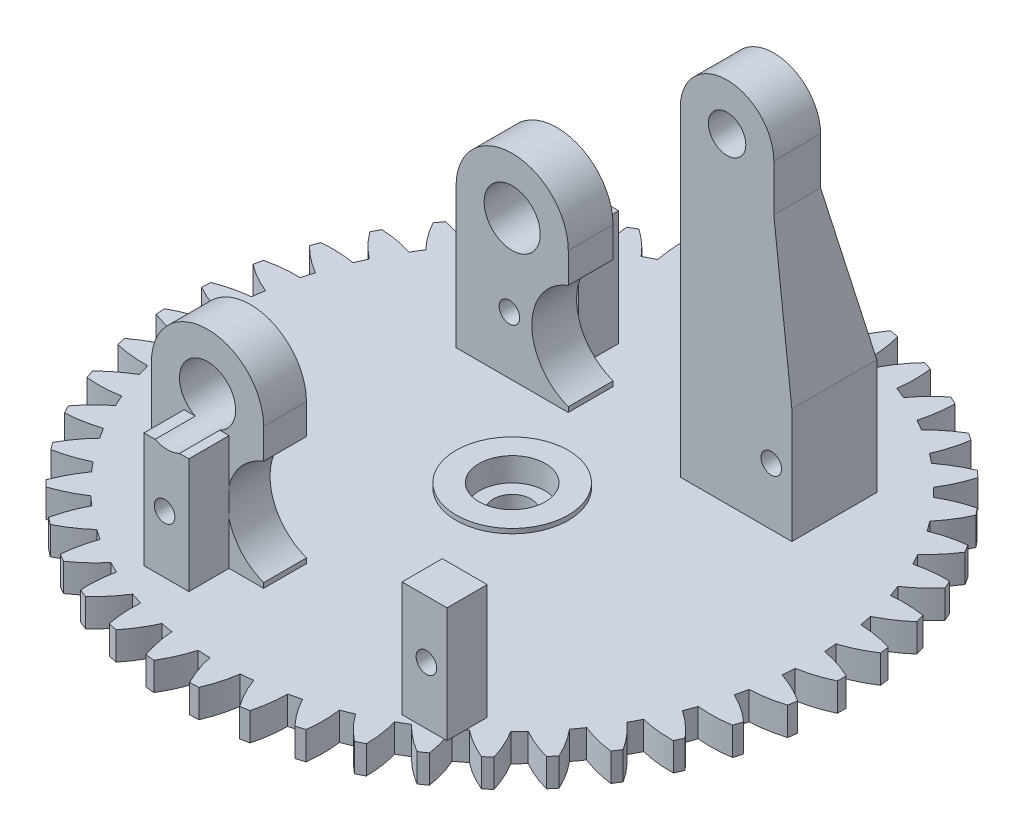
from build123d import *

# Parameters (mm, degrees)
SKETCH1_R                                 = 36
BOSS_EXTRUDE1_DEPTH                       = 3
ISO_START                                 = -50.576879948
ISO_SPUR_GEAR_1_5M_45T_20PA_3FW_2_R       = 0.4
ISO_SPUR_GEAR_1_5M_45T_20PA_3FW_S45_DEPTH = 3
BODY_MOVE_COPY2_ANGLE                     = 90
BOSS_EXTRUDE2_DEPTH                       = 3.5
BOSS_EXTRUDE2_DEPTH_BACK                  = 0.5
SKETCH2_R                                 = 6
CUT_EXTRUDE1_START                        = 1
SKETCH3_R                                 = 3.5
CUT_EXTRUDE1_DEPTH                        = 2.5
CUT_EXTRUDE1_DRAFT                        = -1
CUT_EXTRUDE2_START                        = 1
SKETCH4_R                                 = 2
CUT_EXTRUDE2_DEPTH                        = 1.5
CUT_EXTRUDE2_DRAFT                        = 1
SKETCH5_W                                 = 4.8
SKETCH5_H                                 = 4.3
BOSS_EXTRUDE3_DEPTH                       = 12.3
BOSS_EXTRUDE4_DEPTH                       = 5
SKETCH7_W                                 = 10
SKETCH7_H                                 = 5
BOSS_EXTRUDE5_DEPTH                       = 5
SKETCH8_W                                 = 11.922832302
SKETCH8_H                                 = 4.783876327
BOSS_EXTRUDE6_DEPTH                       = 12.3
LOFT2_START                               = -19.083876327
LOFT2_DEPTH                               = 9.083876327
LOFT2_START_2                             = 22.132052431
LOFT2_2_DEPTH                             = 4.867947569
SKETCH10_R                                = 6
BOSS_EXTRUDE7_DEPTH                       = 4.576618537
BOSS_EXTRUDE9_REACH                       = 93.866
BOSS_EXTRUDE9_END_RADIUS                  = 6
SKETCH12_W                                = 12
SKETCH12_H                                = 4.576618537
SKETCH13_R                                = 6
BOSS_EXTRUDE10_DEPTH                      = 4.783876327
BOSS_EXTRUDE11_REACH                      = 93.866
BOSS_EXTRUDE11_END_RADIUS                 = 6
SKETCH14_W                                = 12
SKETCH14_H                                = 4.783876327
CUT_EXTRUDE3_START                        = -10
SKETCH15_R                                = 6
CUT_EXTRUDE3_DEPTH                        = 4.783876327
CUT_EXTRUDE5_START                        = 18
SKETCH15_2_R                              = 6
CUT_EXTRUDE5_DEPTH                        = 4.576618537
CUT_EXTRUDE4_REACH                        = 95.188
SKETCH16_R                                = 3
SKETCH16_R_2                              = 2
SKETCH16_R_3                              = 1.1
CUT_EXTRUDE4_DIRECTION_2_REACH            = 95.188


with BuildPart() as part:
    # Sketch1 → Boss-Extrude1 (new body)
    with BuildSketch(Plane(origin=(0, 0, 0), x_dir=(1, 0, 0), z_dir=(0, 1, 0))):
        with Locations(Location((-40, 0, 0), (0, 0, 270))):
            Circle(SKETCH1_R)
    extrude(amount=BOSS_EXTRUDE1_DEPTH)


with BuildPart() as body_2:
    # ISO - Spur gear 1.5M 45T 20PA 3FW ---S45: read off the stored shape, not the designer's step
    # ISO - Spur gear 1.5M 45T 20PA 3FW -- 2 → ISO - Spur gear 1.5M 45T 20PA 3FW ---S45 (new body)
    with BuildSketch(Plane.YZ.offset(ISO_START)):
        with BuildLine():
            ThreePointArc((5.658725048, 38.151617139), (5.18462833, 38.204692645), (4.709856745, 38.251347216))
            ThreePointArc((4.709856745, 38.251347216), (3.88030129, 36.659989079), (3.269152011, 34.972659967))
            ThreePointArc((3.269152011, 34.972659967), (2.612386558, 35.002379054), (1.955147854, 35.018546004))
            ThreePointArc((1.955147854, 35.018546004), (1.463189432, 36.744396485), (0.746662265, 38.389745017))
            ThreePointArc((0.746662265, 38.389745017), (0.269792741, 38.376322486), (-0.206851461, 38.356447584))
            ThreePointArc((-0.206851461, 38.356447584), (-0.806859492, 36.66512463), (-1.177230284, 34.909160949))
            ThreePointArc((-1.177230284, 34.909160949), (-1.831740238, 34.847186726), (-2.484832745, 34.771726392))
            ThreePointArc((-2.484832745, 34.771726392), (-3.212195424, 36.412313636), (-4.150737656, 37.941928441))
            ThreePointArc((-4.150737656, 37.941928441), (-4.621098263, 37.862269127), (-5.090337744, 37.776251595))
            ThreePointArc((-5.090337744, 37.776251595), (-5.449119879, 36.017883501), (-5.571503337, 34.227463086))
            ThreePointArc((-5.571503337, 34.227463086), (-6.211018501, 34.075001813), (-6.847253107, 33.909382944))
            ThreePointArc((-6.847253107, 33.909382944), (-7.795862757, 35.432774786), (-8.938152396, 36.816883652))
            ThreePointArc((-8.938152396, 36.816883652), (-9.392849052, 36.672538033), (-9.8455506, 36.522052103))
            ThreePointArc((-9.8455506, 36.522052103), (-9.956123551, 34.730863505), (-9.828137621, 32.940834853))
            ThreePointArc((-9.828137621, 32.940834853), (-10.440210559, 32.700854014), (-11.047203682, 32.448300193))
            ThreePointArc((-11.047203682, 32.448300193), (-12.198596695, 33.824845544), (-13.522400372, 35.036508367))
            ThreePointArc((-13.522400372, 35.036508367), (-13.952582924, 34.830285965), (-14.379935219, 34.618260676))
            ThreePointArc((-14.379935219, 34.618260676), (-14.24014681, 32.829115021), (-13.864282592, 31.074319004))
            ThreePointArc((-13.864282592, 31.074319004), (-14.437, 30.751489553), (-15.00293721, 30.416916454))
            ThreePointArc((-15.00293721, 30.416916454), (-16.33470303, 31.619822424), (-17.814254414, 32.635455565))
            ThreePointArc((-17.814254414, 32.635455565), (-18.211549848, 32.371370266), (-18.605234962, 32.101932448))
            ThreePointArc((-18.605234962, 32.101932448), (-18.217806016, 30.349653422), (-17.601379279, 28.664245148))
            ThreePointArc((-17.601379279, 28.664245148), (-18.123593865, 28.264850594), (-18.637459837, 27.854770301))
            ThreePointArc((-18.637459837, 27.854770301), (-20.123677158, 28.860623693), (-21.730178462, 29.660459008))
            ThreePointArc((-21.730178462, 29.660459008), (-22.086853874, 29.343650931), (-22.439209176, 29.022044886))
            ThreePointArc((-22.439209176, 29.022044886), (-21.811680555, 27.340738607), (-20.966689345, 25.757522631))
            ThreePointArc((-20.966689345, 25.757522631), (-21.428236796, 25.289336733), (-21.880029714, 24.811730993))
            ThreePointArc((-21.880029714, 24.811730993), (-23.491771006, 25.600954016), (-25.193953511, 26.16942362))
            ThreePointArc((-25.193953511, 26.16942362), (-25.50306662, 25.806059075), (-25.807233913, 25.438544497))
            ThreePointArc((-25.807233913, 25.438544497), (-24.95181975, 23.860935679), (-23.894710859, 22.410727499))
            ThreePointArc((-23.894710859, 22.410727499), (-24.286607679, 21.882862965), (-24.667533907, 21.347027829))
            ThreePointArc((-24.667533907, 21.347027829), (-26.373428459, 21.904259155), (-28.138161119, 22.230298434))
            ThreePointArc((-28.138161119, 22.230298434), (-28.39369539, 21.827449897), (-28.643754404, 21.421180041))
            ThreePointArc((-28.643754404, 21.421180041), (-27.577104361, 19.977975045), (-26.328453212, 18.689001314))
            ThreePointArc((-26.328453212, 18.689001314), (-26.643071575, 18.111732425), (-26.945716818, 17.528097316))
            ThreePointArc((-26.945716818, 17.528097316), (-28.712561333, 17.84249107), (-30.505495633, 17.919754041))
            ThreePointArc((-30.505495633, 17.919754041), (-30.702477382, 17.485262502), (-30.893561004, 17.048144947))
            ThreePointArc((-30.893561004, 17.048144947), (-29.636436211, 15.767434118), (-28.220546378, 14.664783242))
            ThreePointArc((-28.220546378, 14.664783242), (-28.451762595, 14.049345882), (-28.670236207, 13.429270592))
            ThreePointArc((-28.670236207, 13.429270592), (-30.463641066, 13.494707458), (-32.249879581, 13.321690284))
            ThreePointArc((-32.249879581, 13.321690284), (-32.384474782, 12.864012626), (-32.512863786, 12.404555369))
            ThreePointArc((-32.512863786, 12.404555369), (-31.089732748, 11.311266285), (-29.534162915, 10.416400111))
            ThreePointArc((-29.534162915, 10.416400111), (-29.677476626, 9.774773067), (-29.807526267, 9.130326657))
            ThreePointArc((-29.807526267, 9.130326657), (-31.592584885, 8.94553298), (-33.337360512, 8.525603244))
            ThreePointArc((-33.337360512, 8.525603244), (-33.406949423, 8.053647642), (-33.470144863, 7.580793496))
            ThreePointArc((-33.470144863, 7.580793496), (-31.908707206, 6.696205786), (-30.243734772, 6.026541865))
            ThreePointArc((-30.243734772, 6.026541865), (-30.296356538, 5.371213677), (-30.33545094, 4.714939564))
            ThreePointArc((-30.33545094, 4.714939564), (-32.077419181, 4.283512143), (-33.746771848, 3.6248433))
            ThreePointArc((-33.746771848, 3.6248433), (-33.75, 3.147795833), (-33.746771848, 2.670748366))
            ThreePointArc((-33.746771848, 2.670748366), (-32.077419181, 2.012079523), (-30.33545094, 1.580652102))
            ThreePointArc((-30.33545094, 1.580652102), (-30.296356538, 0.924377989), (-30.243734772, 0.269049801))
            ThreePointArc((-30.243734772, 0.269049801), (-31.908707206, -0.400614119), (-33.470144863, -1.28520183))
            ThreePointArc((-33.470144863, -1.28520183), (-33.406949423, -1.758055976), (-33.337360512, -2.230011578))
            ThreePointArc((-33.337360512, -2.230011578), (-31.592584885, -2.649941313), (-29.807526267, -2.83473499))
            ThreePointArc((-29.807526267, -2.83473499), (-29.677476626, -3.4791814), (-29.534162915, -4.120808445))
            ThreePointArc((-29.534162915, -4.120808445), (-31.089732748, -5.015674619), (-32.512863786, -6.108963703))
            ThreePointArc((-32.512863786, -6.108963703), (-32.384474782, -6.568420959), (-32.249879581, -7.026098617))
            ThreePointArc((-32.249879581, -7.026098617), (-30.463641066, -7.199115791), (-28.670236207, -7.133678926))
            ThreePointArc((-28.670236207, -7.133678926), (-28.451762595, -7.753754215), (-28.220546378, -8.369191576))
            ThreePointArc((-28.220546378, -8.369191576), (-29.636436211, -9.471842451), (-30.893561004, -10.752553281))
            ThreePointArc((-30.893561004, -10.752553281), (-30.702477382, -11.189670835), (-30.505495633, -11.624162374))
            ThreePointArc((-30.505495633, -11.624162374), (-28.712561333, -11.546899404), (-26.945716818, -11.23250565))
            ThreePointArc((-26.945716818, -11.23250565), (-26.643071575, -11.816140759), (-26.328453212, -12.393409648))
            ThreePointArc((-26.328453212, -12.393409648), (-27.577104362, -13.682383379), (-28.643754404, -15.125588375))
            ThreePointArc((-28.643754404, -15.125588375), (-28.39369539, -15.531858231), (-28.138161119, -15.934706767))
            ThreePointArc((-28.138161119, -15.934706767), (-26.373428459, -15.608667488), (-24.667533907, -15.051436163))
            ThreePointArc((-24.667533907, -15.051436163), (-24.286607679, -15.587271299), (-23.894710859, -16.115135833))
            ThreePointArc((-23.894710859, -16.115135833), (-24.95181975, -17.565344013), (-25.807233913, -19.142952831))
            ThreePointArc((-25.807233913, -19.142952831), (-25.50306662, -19.510467408), (-25.193953511, -19.873831953))
            ThreePointArc((-25.193953511, -19.873831953), (-23.491771005, -19.30536235), (-21.880029714, -18.516139326))
            ThreePointArc((-21.880029714, -18.516139326), (-21.428236796, -18.993745067), (-20.966689345, -19.461930964))
            ThreePointArc((-20.966689345, -19.461930964), (-21.811680555, -21.045146941), (-22.439209176, -22.72645322))
            ThreePointArc((-22.439209176, -22.72645322), (-22.086853874, -23.048059265), (-21.730178462, -23.364867341))
            ThreePointArc((-21.730178462, -23.364867341), (-20.123677157, -22.565032027), (-18.637459837, -21.559178634))
            ThreePointArc((-18.637459837, -21.559178634), (-18.123593865, -21.969258927), (-17.601379279, -22.368653482))
            ThreePointArc((-17.601379279, -22.368653482), (-18.217806016, -24.054061756), (-18.605234962, -25.806340782))
            ThreePointArc((-18.605234962, -25.806340782), (-18.211549847, -26.075778599), (-17.814254414, -26.339863898))
            ThreePointArc((-17.814254414, -26.339863898), (-16.33470303, -25.324230758), (-15.00293721, -24.121324788))
            ThreePointArc((-15.00293721, -24.121324788), (-14.437, -24.455897887), (-13.864282592, -24.778727338))
            ThreePointArc((-13.864282592, -24.778727338), (-14.24014681, -26.533523355), (-14.379935219, -28.32266901))
            ThreePointArc((-14.379935219, -28.32266901), (-13.952582924, -28.534694299), (-13.522400372, -28.7409167))
            ThreePointArc((-13.522400372, -28.7409167), (-12.198596695, -27.529253878), (-11.047203682, -26.152708527))
            ThreePointArc((-11.047203682, -26.152708527), (-10.440210558, -26.405262347), (-9.828137621, -26.645243187))
            ThreePointArc((-9.828137621, -26.645243187), (-9.956123551, -28.435271839), (-9.8455506, -30.226460437))
            ThreePointArc((-9.8455506, -30.226460437), (-9.392849052, -30.376946366), (-8.938152396, -30.521291986))
            ThreePointArc((-8.938152396, -30.521291986), (-7.795862757, -29.13718312), (-6.847253107, -27.613791278))
            ThreePointArc((-6.847253107, -27.613791278), (-6.2110185, -27.779410146), (-5.571503337, -27.93187142))
            ThreePointArc((-5.571503337, -27.93187142), (-5.449119879, -29.722291835), (-5.090337744, -31.480659928))
            ThreePointArc((-5.090337744, -31.480659928), (-4.621098263, -31.56667746), (-4.150737656, -31.646336775))
            ThreePointArc((-4.150737656, -31.646336775), (-3.212195424, -30.11672197), (-2.484832745, -28.476134726))
            ThreePointArc((-2.484832745, -28.476134726), (-1.831740238, -28.55159506), (-1.177230284, -28.613569282))
            ThreePointArc((-1.177230284, -28.613569282), (-0.806859492, -30.369532963), (-0.206851461, -32.060855917))
            ThreePointArc((-0.206851461, -32.060855917), (0.269792741, -32.080730819), (0.746662265, -32.09415335))
            ThreePointArc((0.746662265, -32.09415335), (1.463189432, -30.448804818), (1.955147854, -28.722954337))
            ThreePointArc((1.955147854, -28.722954337), (2.612386558, -28.706787387), (3.269152011, -28.677068301))
            ThreePointArc((3.269152011, -28.677068301), (3.88030129, -30.364397413), (4.709856745, -31.955755549))
            ThreePointArc((4.709856745, -31.955755549), (5.18462833, -31.909100979), (5.658725048, -31.856025472))
            ThreePointArc((5.658725048, -31.856025472), (6.139290765, -30.126968051), (6.386269518, -28.349446049))
            ThreePointArc((6.386269518, -28.349446049), (7.034862015, -28.241966486), (7.681099774, -28.12113254))
            ThreePointArc((7.681099774, -28.12113254), (8.521132216, -29.70698514), (9.564088741, -31.167404484))
            ThreePointArc((9.564088741, -31.167404484), (10.02774682, -31.055128518), (10.489842978, -30.936588029))
            ThreePointArc((10.489842978, -30.936588029), (10.725093579, -29.157475855), (10.722285503, -27.362879776))
            ThreePointArc((10.722285503, -27.362879776), (11.349607678, -27.166179567), (11.972739461, -26.956582655))
            ThreePointArc((11.972739461, -26.956582655), (13.025304789, -28.410091927), (14.261362422, -29.711147077))
            ThreePointArc((14.261362422, -29.711147077), (14.704882418, -29.53543504), (15.14598384, -29.353736823))
            ThreePointArc((15.14598384, -29.353736823), (15.131340441, -27.559198291), (14.878800191, -25.782457906))
            ThreePointArc((14.878800191, -25.782457906), (15.472641933, -25.500365599), (16.060539187, -25.206085287))
            ThreePointArc((16.060539187, -25.206085287), (17.305150414, -26.498960326), (18.710250699, -27.615327722))
            ThreePointArc((18.710250699, -27.615327722), (19.125, -27.37959965), (19.536521149, -27.138280255))
            ThreePointArc((19.536521149, -27.138280255), (19.272268766, -25.363244016), (18.774911752, -23.638941556))
            ThreePointArc((18.774911752, -23.638941556), (19.323714605, -23.276947754), (19.864934581, -22.903711875))
            ThreePointArc((19.864934581, -22.903711875), (21.277366765, -24.010788339), (22.824161022, -24.92073916))
            ThreePointArc((22.824161022, -24.92073916), (23.202067005, -24.629583231), (23.575998091, -24.333339666))
            ThreePointArc((23.575998091, -24.333339666), (23.067280096, -22.612354781), (22.334786806, -20.974051832))
            ThreePointArc((22.334786806, -20.974051832), (22.827868947, -20.539202334), (23.311877412, -20.094275498))
            ThreePointArc((23.311877412, -20.094275498), (24.864639168, -20.994005403), (26.523020808, -21.679828492))
            ThreePointArc((26.523020808, -21.679828492), (26.856727962, -21.338911725), (27.18579084, -20.993510033))
            ThreePointArc((27.18579084, -20.993510033), (26.442508851, -19.360073515), (25.489136433, -17.839657781))
            ThreePointArc((25.489136433, -17.839657781), (25.91690058, -17.340416438), (26.33427686, -16.83245864))
            ThreePointArc((26.33427686, -16.83245864), (27.997145446, -17.507329767), (29.734835956, -17.955676358))
            ThreePointArc((29.734835956, -17.955676358), (30.017849052, -17.57163431), (30.295638888, -17.183797342))
            ThreePointArc((30.295638888, -17.183797342), (29.332260042, -15.669702176), (28.176564807, -14.296766818))
            ThreePointArc((28.176564807, -14.296766818), (28.530685017, -13.742850795), (28.873305358, -13.181748856))
            ThreePointArc((28.873305358, -13.181748856), (30.613914929, -13.618625606), (32.397092139, -13.820769142))
            ThreePointArc((32.397092139, -13.820769142), (32.623902648, -13.401076755), (32.845012579, -12.978353317))
            ThreePointArc((32.845012579, -12.978353317), (31.680287951, -11.613069642), (30.344764191, -10.414337287))
            ThreePointArc((30.344764191, -10.414337287), (30.618347917, -9.816527929), (30.879543604, -9.21320306))
            ThreePointArc((30.879543604, -9.21320306), (32.664015174, -9.403582123), (34.457971569, -9.355588111))
            ThreePointArc((34.457971569, -9.355588111), (34.624164883, -8.90841422), (34.784291255, -8.459032142))
            ThreePointArc((34.784291255, -8.459032142), (33.440890884, -7.269133652), (31.951533051, -6.26793626))
            ThreePointArc((31.951533051, -6.26793626), (32.139255296, -5.637869246), (32.313942452, -5.00406448))
            ThreePointArc((32.313942452, -5.00406448), (34.107543312, -4.944240346), (35.877361571, -4.647042933))
            ThreePointArc((35.877361571, -4.647042933), (35.979702926, -4.181091268), (36.075729062, -3.713797262))
            ThreePointArc((36.075729062, -3.713797262), (34.579800709, -2.722443978), (32.965597458, -1.938268719))
            ThreePointArc((32.965597458, -1.938268719), (33.063804423, -1.288207587), (33.148582961, -0.636259212))
            ThreePointArc((33.148582961, -0.636259212), (34.91640271, -0.327396289), (36.627635334, 0.213219915))
            ThreePointArc((36.627635334, 0.213219915), (36.664132772, 0.688880134), (36.694189633, 1.164990722))
            ThreePointArc((36.694189633, 1.164990722), (35.07484984, 1.938503236), (33.367219802, 2.490393283))
            ThreePointArc((33.367219802, 2.490393283), (33.374, 3.147795833), (33.367219802, 3.805198383))
            ThreePointArc((33.367219802, 3.805198383), (35.074849841, 4.35708843), (36.694189633, 5.130600945))
            ThreePointArc((36.694189633, 5.130600945), (36.664132772, 5.606711533), (36.627635334, 6.082371752))
            ThreePointArc((36.627635334, 6.082371752), (34.91640271, 6.622987955), (33.148582961, 6.931850878))
            ThreePointArc((33.148582961, 6.931850878), (33.063804423, 7.583799253), (32.965597458, 8.233860386))
            ThreePointArc((32.965597458, 8.233860386), (34.579800709, 9.018035645), (36.075729062, 10.009388929))
            ThreePointArc((36.075729062, 10.009388929), (35.979702926, 10.476682935), (35.877361571, 10.942634599))
            ThreePointArc((35.877361571, 10.942634599), (34.107543312, 11.239832012), (32.313942452, 11.299656146))
            ThreePointArc((32.313942452, 11.299656146), (32.139255296, 11.933460912), (31.951533051, 12.563527927))
            ThreePointArc((31.951533051, 12.563527927), (33.440890884, 13.564725318), (34.784291255, 14.754623808))
            ThreePointArc((34.784291255, 14.754623808), (34.624164883, 15.204005886), (34.457971569, 15.651179777))
            ThreePointArc((34.457971569, 15.651179777), (32.664015174, 15.69917379), (30.879543604, 15.508794726))
            ThreePointArc((30.879543604, 15.508794726), (30.618347917, 16.112119595), (30.344764191, 16.709928953))
            ThreePointArc((30.344764191, 16.709928953), (31.680287951, 17.908661308), (32.845012579, 19.273944983))
            ThreePointArc((32.845012579, 19.273944983), (32.623902648, 19.696668421), (32.397092139, 20.116360809))
            ThreePointArc((32.397092139, 20.116360809), (30.613914929, 19.914217272), (28.873305358, 19.477340523))
            ThreePointArc((28.873305358, 19.477340523), (28.530685017, 20.038442462), (28.176564807, 20.592358485))
            ThreePointArc((28.176564807, 20.592358485), (29.332260042, 21.965293842), (30.295638888, 23.479389008))
            ThreePointArc((30.295638888, 23.479389008), (30.017849052, 23.867225976), (29.734835956, 24.251268024))
            ThreePointArc((29.734835956, 24.251268024), (27.997145446, 23.802921433), (26.33427686, 23.128050306))
            ThreePointArc((26.33427686, 23.128050306), (25.91690058, 23.636008104), (25.489136433, 24.135249447))
            ThreePointArc((25.489136433, 24.135249447), (26.442508851, 25.655665181), (27.18579084, 27.289101699))
            ThreePointArc((27.18579084, 27.289101699), (26.856727962, 27.634503392), (26.523020808, 27.975420159))
            ThreePointArc((26.523020808, 27.975420159), (24.864639168, 27.289597069), (23.311877412, 26.389867164))
            ThreePointArc((23.311877412, 26.389867164), (22.827868947, 26.834794), (22.334786806, 27.269643498))
            ThreePointArc((22.334786806, 27.269643498), (23.067280096, 28.907946447), (23.575998091, 30.628931332))
            ThreePointArc((23.575998091, 30.628931332), (23.202067005, 30.925174898), (22.824161022, 31.216330827))
            ThreePointArc((22.824161022, 31.216330827), (21.277366765, 30.306380005), (19.864934581, 29.199303541))
            ThreePointArc((19.864934581, 29.199303541), (19.323714605, 29.572539421), (18.774911752, 29.934533222))
            ThreePointArc((18.774911752, 29.934533222), (19.272268766, 31.658835682), (19.536521149, 33.433871922))
            ThreePointArc((19.536521149, 33.433871922), (19.125, 33.675191317), (18.710250699, 33.910919389))
            ThreePointArc((18.710250699, 33.910919389), (17.305150414, 32.794551992), (16.060539187, 31.501676953))
            ThreePointArc((16.060539187, 31.501676953), (15.472641932, 31.795957265), (14.878800191, 32.078049573))
            ThreePointArc((14.878800191, 32.078049573), (15.131340441, 33.854789958), (15.14598384, 35.64932849))
            ThreePointArc((15.14598384, 35.64932849), (14.704882418, 35.831026707), (14.261362422, 36.006738743))
            ThreePointArc((14.261362422, 36.006738743), (13.025304789, 34.705683594), (11.972739461, 33.252174322))
            ThreePointArc((11.972739461, 33.252174322), (11.349607679, 33.461771234), (10.722285503, 33.658471442))
            ThreePointArc((10.722285503, 33.658471442), (10.725093579, 35.453067521), (10.489842978, 37.232179695))
            ThreePointArc((10.489842978, 37.232179695), (10.02774682, 37.350720184), (9.564088741, 37.46299615))
            ThreePointArc((9.564088741, 37.46299615), (8.521132216, 36.002576806), (7.681099774, 34.416724206))
            ThreePointArc((7.681099774, 34.416724206), (7.034862015, 34.537558153), (6.386269518, 34.645037716))
            ThreePointArc((6.386269518, 34.645037716), (6.139290765, 36.422559718), (5.658725048, 38.151617139))
        make_face()
        with Locations((1.5, 3.147795833)):
            Circle(ISO_SPUR_GEAR_1_5M_45T_20PA_3FW_2_R, mode=Mode.SUBTRACT)
    extrude(amount=ISO_SPUR_GEAR_1_5M_45T_20PA_3FW_S45_DEPTH)


with BuildPart() as body_2_1:
    # Body-Move/Copy2: read off the stored shape, not the designer's step
    # Body-Move/Copy2: moved
    add(body_2.part.moved(Location((50.5768799, 38.5, -3.1477958))).rotate(Axis((0, 0, 0), (0, 0, 1)), BODY_MOVE_COPY2_ANGLE))

    # Sketch2 → Boss-Extrude2 (add, two sides: drawn at the far end of the back side and taken through both)
    with BuildSketch(Plane(origin=(0, 0, 0), x_dir=(1, 0, 0), z_dir=(0, 1, 0)).offset(-BOSS_EXTRUDE2_DEPTH_BACK)):
        with Locations(Location((-40, 0, 0), (0, 0, 270))):
            Circle(SKETCH2_R)
    extrude(amount=BOSS_EXTRUDE2_DEPTH + BOSS_EXTRUDE2_DEPTH_BACK)


with BuildPart() as cut_extrude1_tool:
    # Sketch3 → Cut-Extrude1 (with draft: the straight prism first)
    with BuildSketch(Plane(origin=(0, 0, 0), x_dir=(1, 0, 0), z_dir=(0, 1, 0)).offset(CUT_EXTRUDE1_START)):
        with Locations((-40, 0)):
            Circle(SKETCH3_R)
    extrude(amount=CUT_EXTRUDE1_DEPTH)
    # Cut-Extrude1: the draft: its side faces are tilted about the plane it starts from
    cut_extrude1_sides = [cut_extrude1_tool.faces().sort_by_distance(p)[0] for p in [
        (-43.5, 2.25, 0),
    ]]
    draft(cut_extrude1_sides, Plane(origin=(0, 0, 0), x_dir=(1, 0, 0), z_dir=(0, 1, 0)).offset(CUT_EXTRUDE1_START), CUT_EXTRUDE1_DRAFT)


with BuildPart() as body_2_2:
    add(body_2_1.part)

    # Cut-Extrude1: cut by cut_extrude1_tool
    add(cut_extrude1_tool.part, mode=Mode.SUBTRACT)


with BuildPart() as cut_extrude2_tool:
    # Sketch4 → Cut-Extrude2 (with draft: the straight prism first)
    with BuildSketch(Plane(origin=(0, 0, 0), x_dir=(1, 0, 0), z_dir=(0, 1, 0)).offset(CUT_EXTRUDE2_START)):
        with Locations((-40, 0)):
            Circle(SKETCH4_R)
    extrude(amount=-CUT_EXTRUDE2_DEPTH)
    # Cut-Extrude2: the draft: its side faces are tilted about the plane it starts from
    cut_extrude2_sides = [cut_extrude2_tool.faces().sort_by_distance(p)[0] for p in [
        (-42, 0.25, 0),
    ]]
    draft(cut_extrude2_sides, Plane(origin=(0, 0, 0), x_dir=(1, 0, 0), z_dir=(0, 1, 0)).offset(CUT_EXTRUDE2_START), CUT_EXTRUDE2_DRAFT)


with BuildPart() as body_2_3:
    add(body_2_2.part)

    # Cut-Extrude2: cut by cut_extrude2_tool
    add(cut_extrude2_tool.part, mode=Mode.SUBTRACT)

    # Sketch5 → Boss-Extrude3 (add)
    with BuildSketch(Plane(origin=(0, 3, 0), x_dir=(1, 0, 0), z_dir=(0, 1, 0))):
        with Locations((-50.095834404, -24.726618537)):
            Rectangle(SKETCH5_W, SKETCH5_H)
        with Locations((-22.495834404, -24.726618537)):
            Rectangle(SKETCH5_W, SKETCH5_H)
        with Locations((-50.095834404, 16.933876327)):
            Rectangle(SKETCH5_W, SKETCH5_H)
        with Locations((-22.495834404, 16.933876327)):
            Rectangle(SKETCH5_W, SKETCH5_H)
    extrude(amount=BOSS_EXTRUDE3_DEPTH)

    # Sketch8 → Boss-Extrude6 (add)
    with BuildSketch(Plane(origin=(0, 3, 0), x_dir=(1, 0, 0), z_dir=(0, 1, 0))):
        with Locations((-26.057250555, 12.391938164)):
            Rectangle(SKETCH8_W, SKETCH8_H)
    extrude(amount=BOSS_EXTRUDE6_DEPTH)



with BuildPart() as body_2_2_1:
    # Sketch6 → Boss-Extrude4 (new body)
    with BuildSketch(Plane(origin=(0, 0, -10), x_dir=(-1, 0, 0), z_dir=(0, 0, -1))):
        with BuildLine():
            Line((22.018666706, 37.283628291), (32.018666706, 37.283628291))
            ThreePointArc((32.018666706, 37.283628291), (27.018666706, 42.283628291), (22.018666706, 37.283628291))
        make_face()
    extrude(amount=BOSS_EXTRUDE4_DEPTH)

    # Sketch7 → Boss-Extrude5 (add)
    with BuildSketch(Plane.XZ.offset(-37.283628291)):
        with Locations((-27.018666706, -12.5)):
            Rectangle(SKETCH7_W, SKETCH7_H)
    extrude(amount=BOSS_EXTRUDE5_DEPTH)


with BuildPart() as body_2_4:
    add(body_2_3.part)

    add(body_2_2_1.part)  # Loft2 merges body 2 2
    # Loft2: read off the stored shape, not the designer's step
    # Loft2 outline → Loft2 (add)
    with BuildSketch(Plane.XY.offset(LOFT2_START)):
        Polygon((-32.018666706, 32.283628291), (-32.018666706, 15.3), (-20.095834404, 15.3), (-22.018666706, 32.283628291), align=None)
    extrude(amount=LOFT2_DEPTH)

    # Loft2 2 outline → Loft2 2 (cut)
    with BuildSketch(Plane(origin=(0, 0, 0), x_dir=(1, 0, 0), z_dir=(0, 0.233795448059294, -0.972285805957669)).offset(LOFT2_START_2)):
        Polygon((-20.095834404, -10.414249415), (-32.018666706, -10.414249415), (-32.018666706, -27.881981831), (-22.018666706, -27.881981831), align=None)
    extrude(amount=LOFT2_2_DEPTH, mode=Mode.SUBTRACT)

    # Sketch10 → Boss-Extrude7 (add)
    with BuildSketch(Plane.XY.offset(18)):
        with Locations(Location((-50, 18, 0), (0, 0, 245.419431873))):
            Circle(SKETCH10_R)
    extrude(amount=BOSS_EXTRUDE7_DEPTH)

    # Boss-Extrude9: up to this cylinder (the profile starts outside it)
    boss_extrude9_end = Plane(origin=(-50, 18, 20.288309), z_dir=(0, 0, -1)) * Cylinder(BOSS_EXTRUDE9_END_RADIUS, 200.732, mode=Mode.PRIVATE)
    # Sketch12 → Boss-Extrude9 (add, up to the surface)
    with BuildSketch(Plane(origin=(0, 3, 0), x_dir=(1, 0, 0), z_dir=(0, 1, 0)), mode=Mode.PRIVATE) as boss_extrude9_sk1:
        with Locations((-50, -20.288309269)):
            Rectangle(SKETCH12_W, SKETCH12_H)
    boss_extrude9_tool1 = extrude(boss_extrude9_sk1.sketch, amount=BOSS_EXTRUDE9_REACH, mode=Mode.PRIVATE) - boss_extrude9_end
    add(boss_extrude9_tool1.solids().sort_by_distance((-50, 3, 20.288309))[0])

    # Sketch13 → Boss-Extrude10 (add)
    with BuildSketch(Plane(origin=(0, 0, -10), x_dir=(-1, 0, 0), z_dir=(0, 0, -1))):
        with Locations(Location((50, 18, 0), (0, 0, 247.416614304))):
            Circle(SKETCH13_R)
    extrude(amount=BOSS_EXTRUDE10_DEPTH)

    # Boss-Extrude11: up to this cylinder (the profile starts outside it)
    boss_extrude11_end = Plane(origin=(-50, 18, -12.391938), z_dir=(0, 0, 1)) * Cylinder(BOSS_EXTRUDE11_END_RADIUS, 200.732, mode=Mode.PRIVATE)
    # Sketch14 → Boss-Extrude11 (add, up to the surface)
    with BuildSketch(Plane(origin=(0, 3, 0), x_dir=(1, 0, 0), z_dir=(0, 1, 0)), mode=Mode.PRIVATE) as boss_extrude11_sk1:
        with Locations((-50, 12.391938164)):
            Rectangle(SKETCH14_W, SKETCH14_H)
    boss_extrude11_tool1 = extrude(boss_extrude11_sk1.sketch, amount=BOSS_EXTRUDE11_REACH, mode=Mode.PRIVATE) - boss_extrude11_end
    add(boss_extrude11_tool1.solids().sort_by_distance((-50, 3, -12.391938))[0])

    # Sketch15 → Cut-Extrude3 (cut)
    with BuildSketch(Plane.XY.offset(CUT_EXTRUDE3_START)):
        with Locations((-41.895834404, 9.15)):
            Circle(SKETCH15_R)
    extrude(amount=-CUT_EXTRUDE3_DEPTH, mode=Mode.SUBTRACT)

    # Sketch15<2> → Cut-Extrude5 (cut)
    with BuildSketch(Plane.XY.offset(CUT_EXTRUDE5_START)):
        with Locations((-41.895834404, 9.15)):
            Circle(SKETCH15_2_R)
    extrude(amount=CUT_EXTRUDE5_DEPTH, mode=Mode.SUBTRACT)

    # Cut-Extrude4: up to this face of the body (flat: up to its plane)
    cut_extrude4_end = Plane(body_2_4.part.faces().sort_by_distance((-50.095834404, 9.15, -19.083876327))[0])
    # Sketch16 → Cut-Extrude4 (cut, up to the picked face)
    with BuildSketch(Plane.XY, mode=Mode.PRIVATE) as cut_extrude4_sk1:
        with Locations(Location((-50, 18, 0), (0, 0, 295.841932763))):
            Circle(SKETCH16_R)
    cut_extrude4_tool1 = split(extrude(cut_extrude4_sk1.sketch, amount=-CUT_EXTRUDE4_REACH, mode=Mode.PRIVATE), bisect_by=cut_extrude4_end, keep=Keep.BOTH, mode=Mode.PRIVATE)
    # Sketch16 → Cut-Extrude4 (cut, up to the picked face)
    with BuildSketch(Plane.XY, mode=Mode.PRIVATE) as cut_extrude4_sk2:
        with Locations((-27.018666706, 37.283628291)):
            Circle(SKETCH16_R_2)
    cut_extrude4_tool2 = split(extrude(cut_extrude4_sk2.sketch, amount=-CUT_EXTRUDE4_REACH, mode=Mode.PRIVATE), bisect_by=cut_extrude4_end, keep=Keep.BOTH, mode=Mode.PRIVATE)
    # Sketch16 → Cut-Extrude4 (cut, up to the picked face)
    with BuildSketch(Plane.XY, mode=Mode.PRIVATE) as cut_extrude4_sk3:
        with Locations((-22.295834404, 9.15)):
            Circle(SKETCH16_R_3)
    cut_extrude4_tool3 = split(extrude(cut_extrude4_sk3.sketch, amount=-CUT_EXTRUDE4_REACH, mode=Mode.PRIVATE), bisect_by=cut_extrude4_end, keep=Keep.BOTH, mode=Mode.PRIVATE)
    # Sketch16 → Cut-Extrude4 (cut, up to the picked face)
    with BuildSketch(Plane.XY, mode=Mode.PRIVATE) as cut_extrude4_sk4:
        with Locations((-50.295834404, 9.15)):
            Circle(SKETCH16_R_3)
    cut_extrude4_tool4 = split(extrude(cut_extrude4_sk4.sketch, amount=-CUT_EXTRUDE4_REACH, mode=Mode.PRIVATE), bisect_by=cut_extrude4_end, keep=Keep.BOTH, mode=Mode.PRIVATE)
    add(cut_extrude4_tool1.solids().sort_by(Axis((-50, 18, 0), (0, 0, -1)))[0], mode=Mode.SUBTRACT)
    add(cut_extrude4_tool2.solids().sort_by(Axis((-27.018667, 37.283628, 0), (0, 0, -1)))[0], mode=Mode.SUBTRACT)
    add(cut_extrude4_tool3.solids().sort_by(Axis((-22.295834, 9.15, 0), (0, 0, -1)))[0], mode=Mode.SUBTRACT)
    add(cut_extrude4_tool4.solids().sort_by(Axis((-50.295834, 9.15, 0), (0, 0, -1)))[0], mode=Mode.SUBTRACT)

    # Cut-Extrude4 direction 2: up to this face of the body (flat: up to its plane)
    cut_extrude4_direction_2_end = Plane(body_2_4.part.faces().sort_by_distance((-50.095834404, 9.15, 26.876618537))[0])
    # Sketch16 → Cut-Extrude4 direction 2 (cut, up to the picked face)
    with BuildSketch(Plane.XY, mode=Mode.PRIVATE) as cut_extrude4_direction_2_sk1:
        with Locations(Location((-50, 18, 0), (0, 0, 295.841932763))):
            Circle(SKETCH16_R)
    cut_extrude4_direction_2_tool1 = split(extrude(cut_extrude4_direction_2_sk1.sketch, amount=CUT_EXTRUDE4_DIRECTION_2_REACH, mode=Mode.PRIVATE), bisect_by=cut_extrude4_direction_2_end, keep=Keep.BOTH, mode=Mode.PRIVATE)
    # Sketch16 → Cut-Extrude4 direction 2 (cut, up to the picked face)
    with BuildSketch(Plane.XY, mode=Mode.PRIVATE) as cut_extrude4_direction_2_sk2:
        with Locations((-27.018666706, 37.283628291)):
            Circle(SKETCH16_R_2)
    cut_extrude4_direction_2_tool2 = split(extrude(cut_extrude4_direction_2_sk2.sketch, amount=CUT_EXTRUDE4_DIRECTION_2_REACH, mode=Mode.PRIVATE), bisect_by=cut_extrude4_direction_2_end, keep=Keep.BOTH, mode=Mode.PRIVATE)
    # Sketch16 → Cut-Extrude4 direction 2 (cut, up to the picked face)
    with BuildSketch(Plane.XY, mode=Mode.PRIVATE) as cut_extrude4_direction_2_sk3:
        with Locations((-22.295834404, 9.15)):
            Circle(SKETCH16_R_3)
    cut_extrude4_direction_2_tool3 = split(extrude(cut_extrude4_direction_2_sk3.sketch, amount=CUT_EXTRUDE4_DIRECTION_2_REACH, mode=Mode.PRIVATE), bisect_by=cut_extrude4_direction_2_end, keep=Keep.BOTH, mode=Mode.PRIVATE)
    # Sketch16 → Cut-Extrude4 direction 2 (cut, up to the picked face)
    with BuildSketch(Plane.XY, mode=Mode.PRIVATE) as cut_extrude4_direction_2_sk4:
        with Locations((-50.295834404, 9.15)):
            Circle(SKETCH16_R_3)
    cut_extrude4_direction_2_tool4 = split(extrude(cut_extrude4_direction_2_sk4.sketch, amount=CUT_EXTRUDE4_DIRECTION_2_REACH, mode=Mode.PRIVATE), bisect_by=cut_extrude4_direction_2_end, keep=Keep.BOTH, mode=Mode.PRIVATE)
    add(cut_extrude4_direction_2_tool1.solids().sort_by(Axis((-50, 18, 0), (0, 0, 1)))[0], mode=Mode.SUBTRACT)
    add(cut_extrude4_direction_2_tool2.solids().sort_by(Axis((-27.018667, 37.283628, 0), (0, 0, 1)))[0], mode=Mode.SUBTRACT)
    add(cut_extrude4_direction_2_tool3.solids().sort_by(Axis((-22.295834, 9.15, 0), (0, 0, 1)))[0], mode=Mode.SUBTRACT)
    add(cut_extrude4_direction_2_tool4.solids().sort_by(Axis((-50.295834, 9.15, 0), (0, 0, 1)))[0], mode=Mode.SUBTRACT)


solid = body_2_4.part
